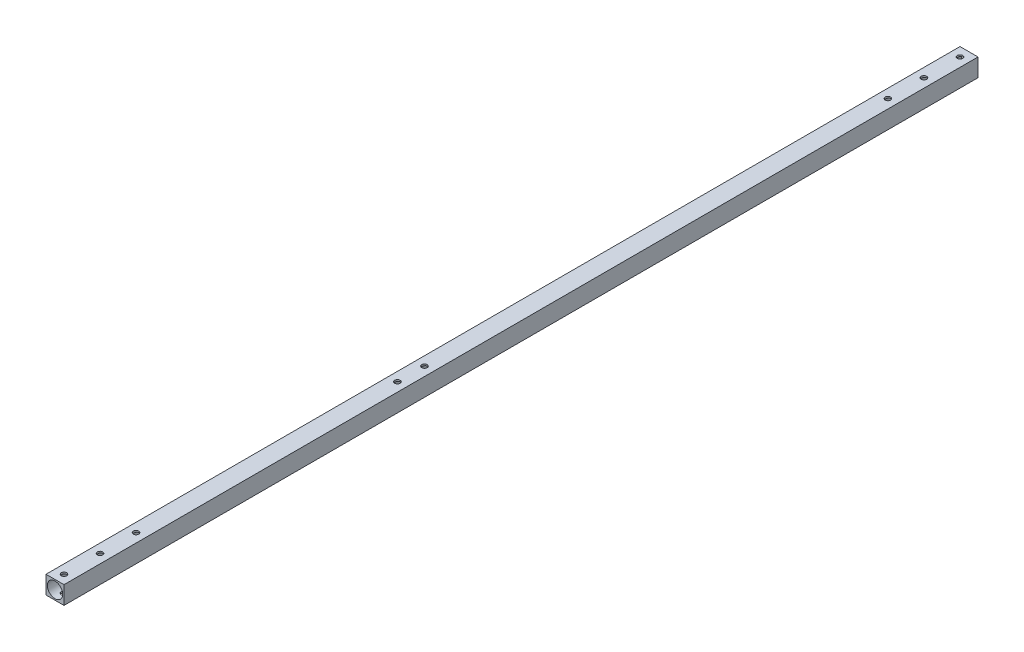
from build123d import *

# Parameters (mm, degrees)
SKETCH1_W           = 10
SKETCH1_H           = 10
SKETCH1_R           = 4.25
BOSS_EXTRUDE1_DEPTH = 507.4
SKETCH2_R           = 1.5
CUT_EXTRUDE1_DEPTH  = 508.523162033


with BuildPart() as part:
    # Sketch1 → Boss-Extrude1 (new body)
    with BuildSketch(Plane.XY):
        Rectangle(SKETCH1_W, SKETCH1_H)
        Circle(SKETCH1_R, mode=Mode.SUBTRACT)
    extrude(amount=BOSS_EXTRUDE1_DEPTH)

    # Sketch2 → Cut-Extrude1 (cut, through all)
    with BuildSketch(Plane(origin=(0, 5, 0), x_dir=(1, 0, 0), z_dir=(0, 1, 0))):
        with Locations((0, -5)):
            Circle(SKETCH2_R)
        with Locations((0, -25)):
            Circle(SKETCH2_R)
        with Locations((0, -45)):
            Circle(SKETCH2_R)
        with Locations((0, -502.4)):
            Circle(SKETCH2_R)
        with Locations((0, -482.4)):
            Circle(SKETCH2_R)
        with Locations((0, -462.4)):
            Circle(SKETCH2_R)
        with Locations((0, -302.3)):
            Circle(SKETCH2_R)
        with Locations((0, -317.3)):
            Circle(SKETCH2_R)
    extrude(amount=-CUT_EXTRUDE1_DEPTH, mode=Mode.SUBTRACT)


solid = part.part
